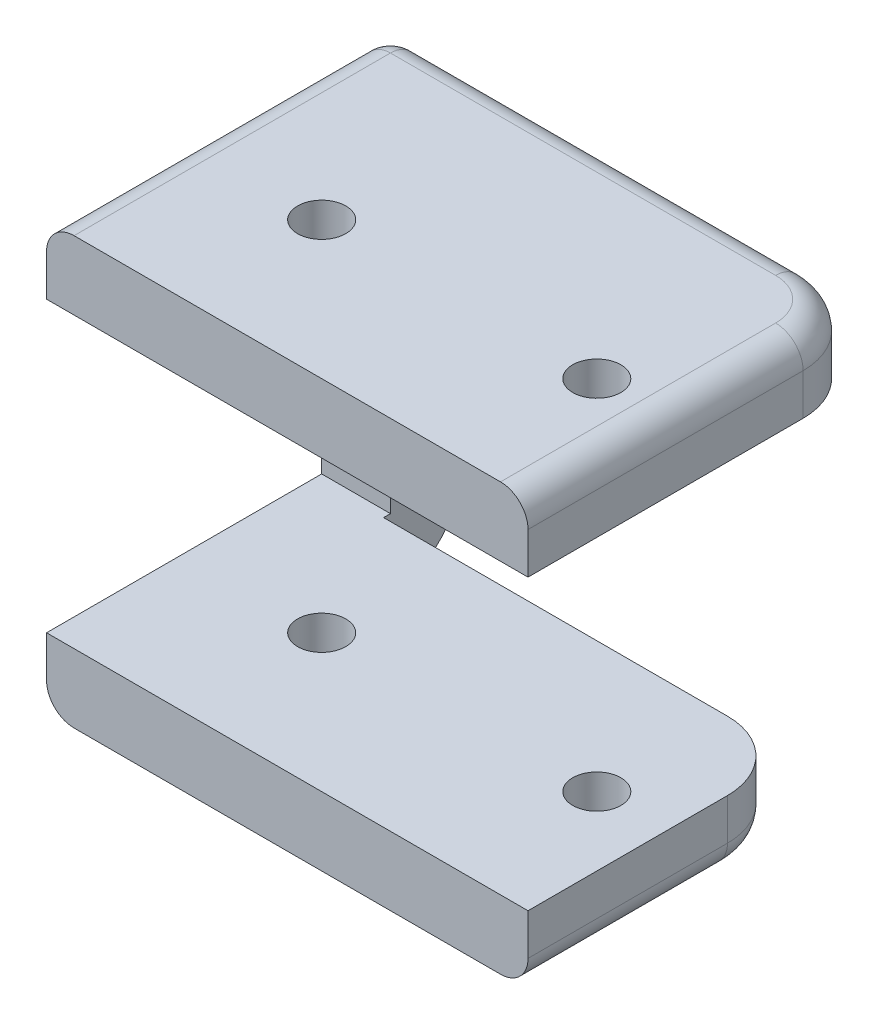
from build123d import *

# Parameters (mm, degrees)
SKETCH1_W           = 30
SKETCH1_H           = 25
SKETCH1_R           = 1.75
BOSS_EXTRUDE1_DEPTH = 5
BOSS_EXTRUDE2_DEPTH = 5
SKETCH3_W           = 19.5
SKETCH3_H           = 5
BOSS_EXTRUDE3_DEPTH = 30
SKETCH4_R           = 1.75
CUT_EXTRUDE1_DEPTH  = 39.951893407
FILLET1_R           = 5
FILLET2_R           = 2


with BuildPart() as part:
    # Sketch1 → Boss-Extrude1 (new body)
    with BuildSketch(Plane(origin=(0, 0, 0), x_dir=(1, 0, 0), z_dir=(0, 1, 0))):
        Rectangle(SKETCH1_W, SKETCH1_H)
        with Locations((-10, -2.5)):
            Circle(SKETCH1_R, mode=Mode.SUBTRACT)
        with Locations((10, -2.5)):
            Circle(SKETCH1_R, mode=Mode.SUBTRACT)
    extrude(amount=BOSS_EXTRUDE1_DEPTH)

    # Sketch2 → Boss-Extrude2 (add)
    with BuildSketch(Plane.ZY.offset(15)):
        Polygon((-12.5, 5), (12.5, 5), (12.5, 0), (-7.5, 0), (-7.5, -21), (12.5, -21), (12.5, -26), (-12.5, -26), align=None)
    extrude(amount=BOSS_EXTRUDE2_DEPTH)

    # Sketch3 → Boss-Extrude3 (add)
    with BuildSketch(Plane(origin=(-15, 0, 0), x_dir=(0, 0, -1), z_dir=(1, 0, 0))):
        with Locations((-2.75, -23.5)):
            Rectangle(SKETCH3_W, SKETCH3_H)
    extrude(amount=BOSS_EXTRUDE3_DEPTH)

    # Sketch4 → Cut-Extrude1 (cut, through all)
    with BuildSketch(Plane.XZ.offset(26)):
        with Locations((-10, 2.5)):
            Circle(SKETCH4_R)
        with Locations((10, 2.5)):
            Circle(SKETCH4_R)
    extrude(amount=-CUT_EXTRUDE1_DEPTH, mode=Mode.SUBTRACT)

    # Fillet1
    fillet1_edges = [part.edges().sort_by_distance(p)[0] for p in [
        (-17.5, -26, -12.5),
        (15, -23.5, -7),
        (15, 2.5, -12.5),
    ]]
    fillet(fillet1_edges, radius=FILLET1_R)

    # Fillet2
    fillet2_edges = [part.edges().sort_by_distance(p)[0] for p in [
        (15, -26, 5.25),
        (13.535533906, -26, -5.535533906),
        (-20, -26, 2.5),
        (-20, -24.535533906, -11.035533906),
        (-5, 5, -12.5),
        (13.535533906, 5, -11.035533906),
        (-2.5, -26, -7),
        (-20, -8, -12.5),
        (15, 5, 2.5),
        (-20, 5, 0),
    ]]
    fillet(fillet2_edges, radius=FILLET2_R)


solid = part.part
